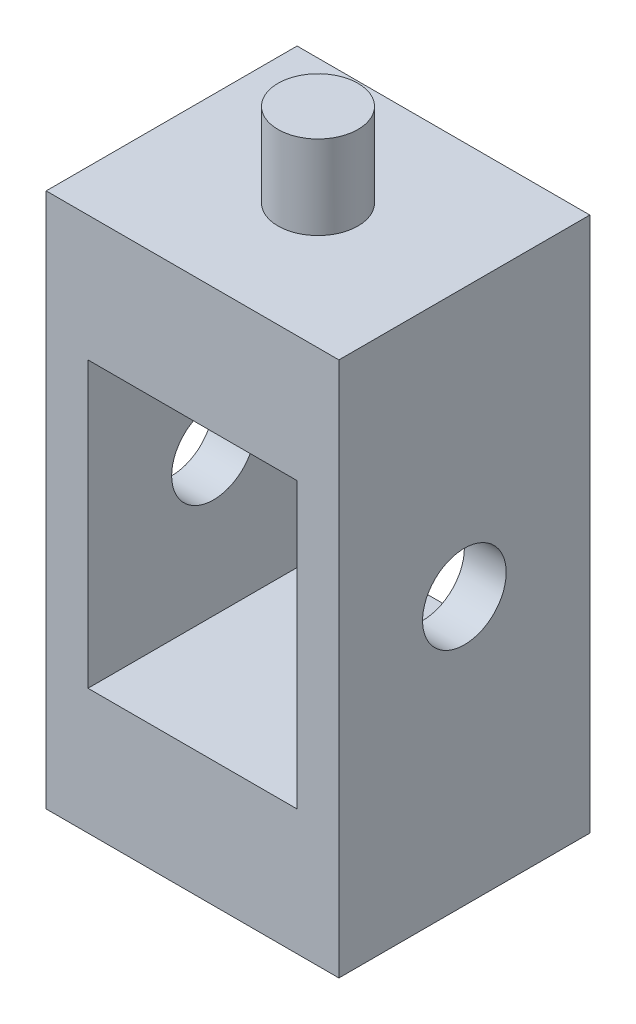
from build123d import *

# Parameters (mm, degrees)
EXTRUDE_1_DEPTH     = 15
SKETCH_2_R          = 5
CUT_EXTRUDE_1_DEPTH = 44.011626335
SKETCH_3_R          = 4.781082329
EXTRUDE_2_DEPTH     = 10


with BuildPart() as part:
    # 草图1 → 凸台-拉伸1 (new, symmetric)
    with BuildSketch(Plane.XY):
        Polygon((-17.5, -20), (17.5, -20), (17.5, 20), (12.5, 20), (12.5, -5), (-12.5, -5), (-12.5, 20), (-17.5, 20), align=None)
    extrude_1 = extrude(amount=EXTRUDE_1_DEPTH, both=True)

    # 草图2 → 切除-拉伸1 (cut, through all)
    with BuildSketch(Plane(origin=(17.5, 0, 0), x_dir=(0, 0, -1), z_dir=(1, 0, 0))):
        with Locations((0, 12)):
            Circle(SKETCH_2_R)
    cut_extrude_1 = extrude(amount=-CUT_EXTRUDE_1_DEPTH, mode=Mode.SUBTRACT)

    # 草图3 → 凸台-拉伸2 (add)
    with BuildSketch(Plane.XZ.offset(20)):
        Circle(SKETCH_3_R)
    extrude_2 = extrude(amount=EXTRUDE_2_DEPTH)

    # 镜向1: 凸台-拉伸1, 切除-拉伸1, 凸台-拉伸2 across plane
    add(extrude_1.mirror(Plane.ZX.offset(12)))
    add(cut_extrude_1.mirror(Plane.ZX.offset(12)), mode=Mode.SUBTRACT)
    add(extrude_2.mirror(Plane.ZX.offset(12)))


solid = part.part
